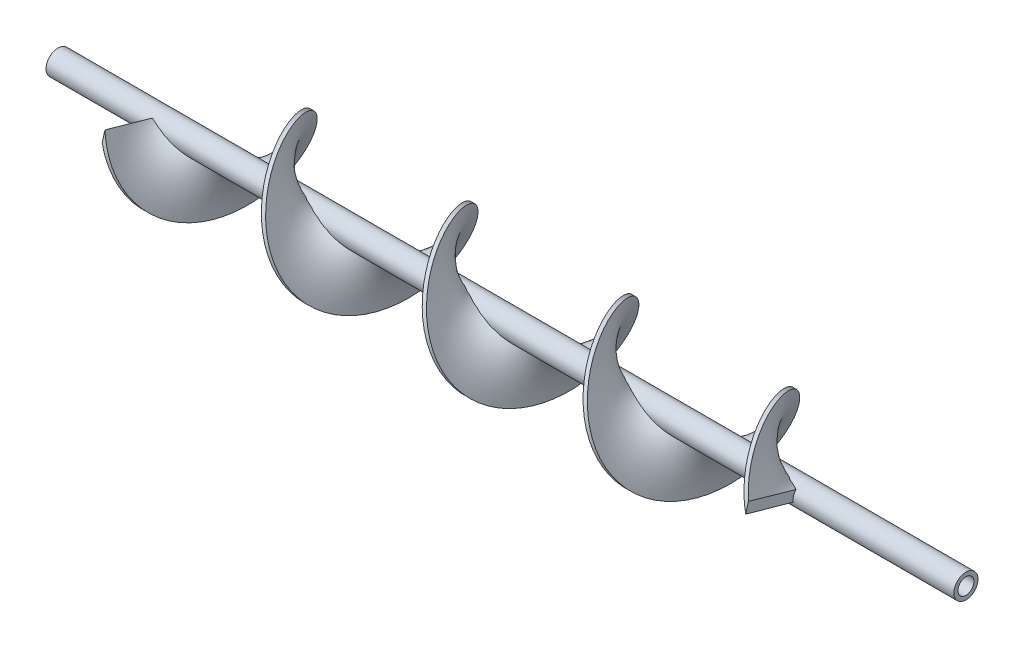
from build123d import *

# Parameters (mm, degrees)
AUFSATZ_LINEAR_AUSTRAGEN1_DEPTH      = 51.5
AUFSATZ_LINEAR_AUSTRAGEN1_DEPTH_BACK = 415
SKIZZE3_R                            = 6
SKIZZE3_R_2                          = 4
AUSTRAGUNG1_PITCH                    = 80
AUSTRAGUNG1_HEIGHT                   = 320
AUSTRAGUNG1_RADIUS                   = 4
SKETCH1_R                            = 6
SKETCH1_R_2                          = 4
BOSS_EXTRUDE1_DEPTH                  = 65
SKETCH2_R                            = 6
CUT_EXTRUDE1_DEPTH                   = 80


with BuildPart() as part:
    # Skizze3 → Aufsatz-Linear austragen1 (new, two sides: drawn at the far end of the back side and taken through both)
    with BuildSketch(Plane(origin=(0, 0, 0), x_dir=(0, 0, -1), z_dir=(1, 0, 0)).offset(-AUFSATZ_LINEAR_AUSTRAGEN1_DEPTH_BACK)):
        Circle(SKIZZE3_R)
        Circle(SKIZZE3_R_2, mode=Mode.SUBTRACT)
    extrude(amount=AUFSATZ_LINEAR_AUSTRAGEN1_DEPTH + AUFSATZ_LINEAR_AUSTRAGEN1_DEPTH_BACK)

    # Sketch1 → Boss-Extrude1 (add)
    with BuildSketch(Plane(origin=(51.5, 0, 0), x_dir=(0, 0, -1), z_dir=(1, 0, 0))):
        Circle(SKETCH1_R)
        Circle(SKETCH1_R_2, mode=Mode.SUBTRACT)
    extrude(amount=BOSS_EXTRUDE1_DEPTH)

    # Sketch2 → Cut-Extrude1 (cut)
    with BuildSketch(Plane.ZY.offset(415)):
        Circle(SKETCH2_R)
    extrude(amount=-CUT_EXTRUDE1_DEPTH, mode=Mode.SUBTRACT)


with BuildPart() as body_2:
    # Austragung1: sweep along a helix
    with BuildLine() as austragung1_path:
        Helix(AUSTRAGUNG1_PITCH, AUSTRAGUNG1_HEIGHT, AUSTRAGUNG1_RADIUS, center=(36.5, 0, 0), direction=(-1, 0, 0))
    # Skizze2 → Austragung1 (sweep)
    with BuildSketch(Plane(origin=(0, 0, 0), x_dir=(0, 0, -1), z_dir=(1, 0, 0))):
        with BuildLine():
            Line((3.122498999, -2.5), (30, -2.5))
            Line((30, -2.5), (30, 2.5))
            Line((30, 2.5), (3.122498999, 2.5))
            ThreePointArc((3.122498999, 2.5), (4, 0), (3.122498999, -2.5))
        make_face()
    sweep(path=austragung1_path.line, is_frenet=True)


solid = Compound([part.part, body_2.part])
